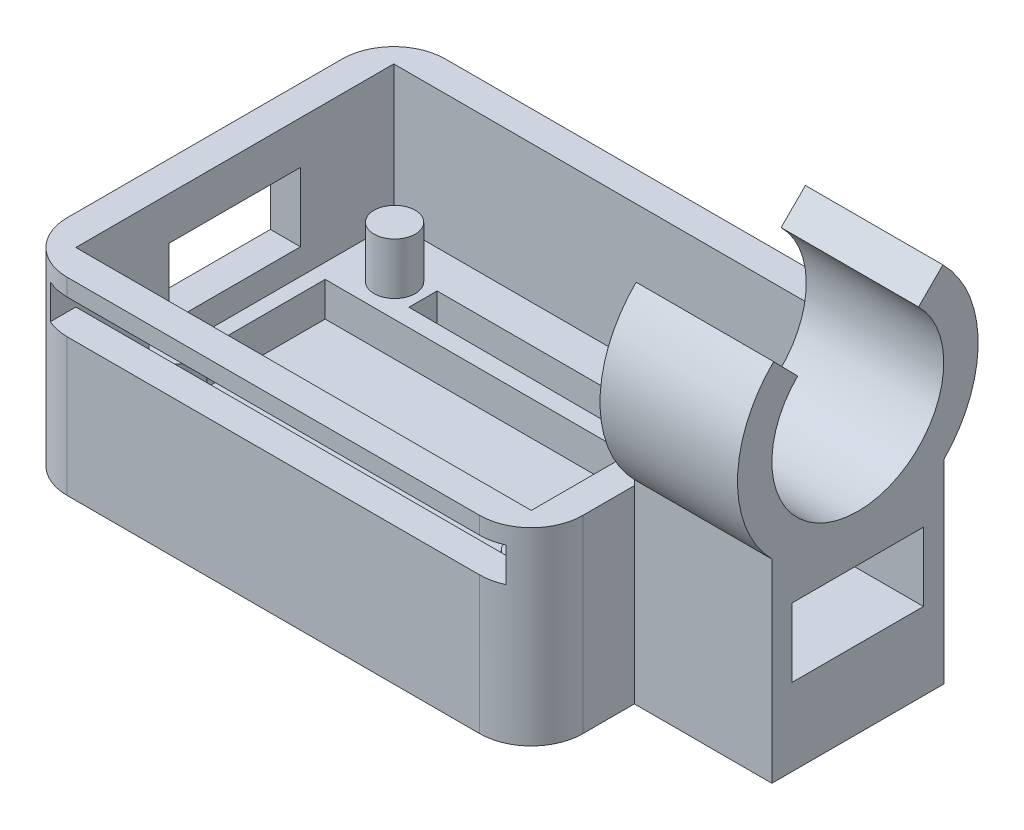
from build123d import *

# Parameters (mm, degrees)
SKETCH1_W                = 30
SKETCH1_H                = 22
BOSS_EXTRUDE1_DEPTH      = 11
SKETCH2_W                = 26.5
SKETCH2_H                = 18.5
CUT_EXTRUDE1_DEPTH       = 8
SKETCH3_R                = 1.2
BOSS_EXTRUDE2_DEPTH      = 3
CUT_EXTRUDE2_DEPTH       = 2
SKETCH5_W                = 7.639048366
SKETCH5_H                = 4
CUT_EXTRUDE3_DEPTH       = 34.793490497
CUT_EXTRUDE4_REACH       = 30.81
SKETCH6_W                = 26.5
SKETCH6_H                = 2
SKETCH8_W                = 24.775890618
SKETCH8_H                = 8.79217469
CUT_EXTRUDE5_DEPTH       = 2
FILLET1_R                = 3
SKETCH10_R               = 7
SKETCH10_R_2             = 5
BOSS_EXTRUDE4_DEPTH      = 8
BOSS_EXTRUDE8_REACH      = 36.471
BOSS_EXTRUDE8_END_RADIUS = 7
SKETCH15_W               = 8
SKETCH15_H               = 10
SKETCH16_W               = 7.639048366
SKETCH16_H               = 4
CUT_EXTRUDE7_DEPTH       = 46.861094623
CUT_EXTRUDE8_REACH       = 47.861


with BuildPart() as part:
    # Sketch1 → Boss-Extrude1 (new body)
    with BuildSketch(Plane(origin=(0, 0, 0), x_dir=(1, 0, 0), z_dir=(0, 1, 0))):
        Rectangle(SKETCH1_W, SKETCH1_H)
    extrude(amount=BOSS_EXTRUDE1_DEPTH)

    # Sketch2 → Cut-Extrude1 (cut)
    with BuildSketch(Plane(origin=(0, 11, 0), x_dir=(1, 0, 0), z_dir=(0, 1, 0))):
        Rectangle(SKETCH2_W, SKETCH2_H)
    extrude(amount=-CUT_EXTRUDE1_DEPTH, mode=Mode.SUBTRACT)

    # Sketch3 → Boss-Extrude2 (add)
    with BuildSketch(Plane(origin=(0, 3, 0), x_dir=(1, 0, 0), z_dir=(0, 1, 0))):
        with Locations(Location((-10.25, -6.3, 0), (0, 0, 90))):
            Circle(SKETCH3_R)
        with Locations(Location((10.25, -6.3, 0), (0, 0, 90))):
            Circle(SKETCH3_R)
        with Locations(Location((10.25, 6.3, 0), (0, 0, 90))):
            Circle(SKETCH3_R)
        with Locations(Location((-10.25, 6.3, 0), (0, 0, 90))):
            Circle(SKETCH3_R)
    extrude(amount=BOSS_EXTRUDE2_DEPTH)

    # Sketch4 → Cut-Extrude2 (cut)
    with BuildSketch(Plane(origin=(0, 3, 0), x_dir=(1, 0, 0), z_dir=(0, 1, 0))):
        Polygon((8.552738998, 7.070702511), (8.552738998, 5.36723461), (-8.55, 5.429297489), (-8.55, 7.070702511), align=None)
    cut_extrude2 = extrude(amount=-CUT_EXTRUDE2_DEPTH, mode=Mode.SUBTRACT)

    # Mirror1: Cut-Extrude2 across plane
    add(cut_extrude2.mirror(Plane.XY), mode=Mode.SUBTRACT)

    # Sketch5 → Cut-Extrude3 (cut, through all)
    with BuildSketch(Plane.ZY.offset(15)):
        with Locations((0, 6.5)):
            Rectangle(SKETCH5_W, SKETCH5_H)
    extrude(amount=-CUT_EXTRUDE3_DEPTH, mode=Mode.SUBTRACT)

    # Sketch6 → Cut-Extrude4 (cut, up to next)
    with BuildSketch(Plane.XY.offset(11), mode=Mode.PRIVATE) as cut_extrude4_sk1:
        with Locations((0, 9)):
            Rectangle(SKETCH6_W, SKETCH6_H)
    cut_extrude4_tool1 = extrude(cut_extrude4_sk1.sketch, amount=-CUT_EXTRUDE4_REACH, mode=Mode.PRIVATE) & part.part
    add(cut_extrude4_tool1.solids().sort_by_distance((0, 9, 11))[0], mode=Mode.SUBTRACT)

    # Sketch8 → Cut-Extrude5 (cut)
    with BuildSketch(Plane(origin=(0, 3, 0), x_dir=(1, 0, 0), z_dir=(0, 1, 0))):
        Rectangle(SKETCH8_W, SKETCH8_H)
    extrude(amount=-CUT_EXTRUDE5_DEPTH, mode=Mode.SUBTRACT)

    # Fillet1
    # the kernel refuses this fillet: 3 mm, written as the material it takes off along each edge
    with BuildSketch(Plane(origin=(-15, -7.5, 11), x_dir=(1, 0, 0), z_dir=(0, 1, 0)), Plane(origin=(-15, -7.5, -11), x_dir=(0, 0, 1), z_dir=(0, 1, 0))) as fillet1_piece_1:
        with BuildLine():
            CenterArc((FILLET1_R, FILLET1_R), FILLET1_R, 180, 90)
            Line((0, FILLET1_R), (0, 0))
            Line((0, 0), (FILLET1_R, 0))
        make_face()
    extrude(amount=26, mode=Mode.SUBTRACT)
    with BuildSketch(Plane(origin=(15, -7.5, 11), x_dir=(-1, 0, 0), z_dir=(0, 1, 0)), Plane(origin=(15, -7.5, -11), x_dir=(0, 0, 1), z_dir=(0, 1, 0))) as fillet1_piece_2:
        with BuildLine():
            CenterArc((FILLET1_R, -FILLET1_R), FILLET1_R, 90, 90)
            Line((0, -FILLET1_R), (0, 0))
            Line((0, 0), (FILLET1_R, 0))
        make_face()
    extrude(amount=26, mode=Mode.SUBTRACT)



with BuildPart() as body_2:
    # Sketch10 → Boss-Extrude4 (new body)
    with BuildSketch(Plane(origin=(15, 0, -26), x_dir=(0, 0, 1), z_dir=(-1, 0, 0))):
        with Locations((26, 16.2)):
            Circle(SKETCH10_R)
        with Locations((26, 16.2)):
            Circle(SKETCH10_R_2, mode=Mode.SUBTRACT)
    extrude(amount=-BOSS_EXTRUDE4_DEPTH)


with BuildPart() as part_1:
    add(part.part)

    add(body_2.part)  # Boss-Extrude8 merges body 2
    # Boss-Extrude8: up to this cylinder (the profile starts outside it)
    boss_extrude8_end = Plane(origin=(19, 16.2, 0), z_dir=(-1, 0, 0)) * Cylinder(BOSS_EXTRUDE8_END_RADIUS, 87.942, mode=Mode.PRIVATE)
    # Sketch15 → Boss-Extrude8 (add, up to the surface)
    with BuildSketch(Plane(origin=(0, 0, 0), x_dir=(1, 0, 0), z_dir=(0, 1, 0)), mode=Mode.PRIVATE) as boss_extrude8_sk1:
        with Locations((19, 0)):
            Rectangle(SKETCH15_W, SKETCH15_H)
    boss_extrude8_tool1 = extrude(boss_extrude8_sk1.sketch, amount=BOSS_EXTRUDE8_REACH, mode=Mode.PRIVATE) - boss_extrude8_end
    add(boss_extrude8_tool1.solids().sort_by_distance((19, 0, 0))[0])

    # Sketch16 → Cut-Extrude7 (cut, through all)
    with BuildSketch(Plane(origin=(23, 0, 0), x_dir=(0, 0, -1), z_dir=(1, 0, 0))):
        with Locations((0, 6.5)):
            Rectangle(SKETCH16_W, SKETCH16_H)
    extrude(amount=-CUT_EXTRUDE7_DEPTH, mode=Mode.SUBTRACT)

    # Sketch17 → Cut-Extrude8 (cut, up to next)
    with BuildSketch(Plane(origin=(23, 0, 0), x_dir=(0, 0, -1), z_dir=(1, 0, 0)), mode=Mode.PRIVATE) as cut_extrude8_sk1:
        with BuildLine():
            Line((-4.898979486, 21.2), (-3.499271061, 19.771428571))
            ThreePointArc((-3.499271061, 19.771428571), (0.025511865, 21.199934914), (3.535533906, 19.735533906))
            Line((3.535533906, 19.735533906), (4.949747468, 21.149747468))
            ThreePointArc((4.949747468, 21.149747468), (0.03571661, 23.19990888), (-4.898979486, 21.2))
        make_face()
    cut_extrude8_tool1 = extrude(cut_extrude8_sk1.sketch, amount=-CUT_EXTRUDE8_REACH, mode=Mode.PRIVATE) & part_1.part
    add(cut_extrude8_tool1.solids().sort_by_distance((23, 21.659424, -0.027856))[0], mode=Mode.SUBTRACT)


solid = part_1.part
